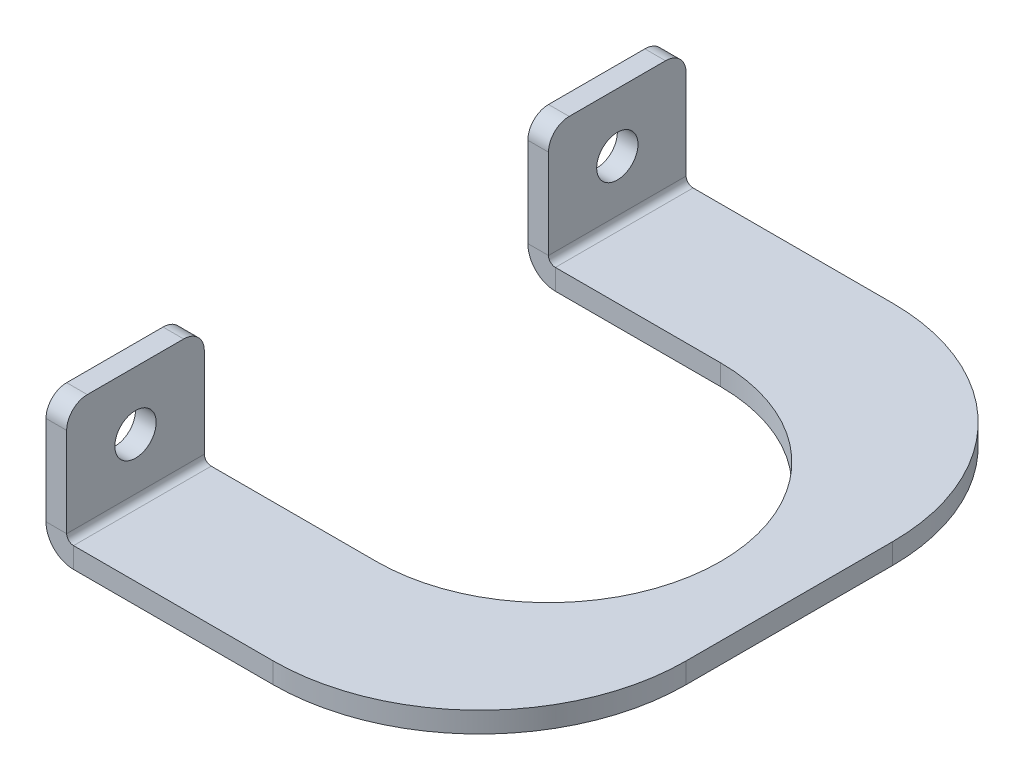
from build123d import *

# Parameters (mm, degrees)
BOSS_EXTRUDE1_DEPTH            = 3
EDGE_FLANGE1_STRIP_W           = 14
EDGE_FLANGE1_STRIP_H           = 3
EDGE_FLANGE1_STRIP_CUT_DEPTH   = 20
EDGE_FLANGE1_STRIP_2_W         = 14
EDGE_FLANGE1_STRIP_2_H         = 3
EDGE_FLANGE1_STRIP_CUT_2_DEPTH = 20
EDGE_FLANGE1_DEPTH             = 20
EDGE_FLANGE1_BEND_DEPTH        = 20
FILLET1_R                      = 3
CUT_EXTRUDE1_REACH             = 79.621
SKETCH12_R                     = 3


# Sheet-metal steps are written as plain solids
with BuildPart() as part:
    # Sketch1 → Boss-Extrude1 (new body)
    with BuildSketch(Plane(origin=(0, 0, 0), x_dir=(1, 0, 0), z_dir=(0, 1, 0))):
        with BuildLine():
            Line((0, 25), (-25, 25))
            Line((-25, 25), (-25, 45))
            Line((-25, 45), (5, 45))
            ThreePointArc((5, 45), (26.213203436, 36.213203436), (35, 15))
            Line((35, 15), (35, -15))
            ThreePointArc((35, -15), (26.213203436, -36.213203436), (5, -45))
            Line((5, -45), (-25, -45))
            Line((-25, -45), (-25, -25))
            Line((-25, -25), (0, -25))
            ThreePointArc((0, -25), (25, 0), (0, 25))
        make_face()
    extrude(amount=BOSS_EXTRUDE1_DEPTH)

    # Edge-Flange1 strip (across the edge) → Edge-Flange1 strip cut (cut)
    with BuildSketch(Plane(origin=(-25, 3, 25), x_dir=(1, 0, 0), z_dir=(0, 0, 1))):
        with Locations((-6, -1.5)):
            Rectangle(EDGE_FLANGE1_STRIP_W, EDGE_FLANGE1_STRIP_H)
    extrude(amount=EDGE_FLANGE1_STRIP_CUT_DEPTH, mode=Mode.SUBTRACT)

    # Edge-Flange1 strip 2 (across the edge) → Edge-Flange1 strip cut 2 (cut)
    with BuildSketch(Plane(origin=(-25, 3, -45), x_dir=(1, 0, 0), z_dir=(0, 0, 1))):
        with Locations((-6, -1.5)):
            Rectangle(EDGE_FLANGE1_STRIP_2_W, EDGE_FLANGE1_STRIP_2_H)
    extrude(amount=EDGE_FLANGE1_STRIP_CUT_2_DEPTH, mode=Mode.SUBTRACT)

    # Edge-Flange1 section (across the edge) → Edge-Flange1 (add)
    with BuildSketch(Plane(origin=(-25, 3, 25), x_dir=(1, 0, 0), z_dir=(0, 0, 1))):
        with BuildLine():
            Line((-3, 1), (-3, 17))
            Line((-3, 17), (0, 17))
            Line((0, 17), (0, 1))
            ThreePointArc((0, 1), (0.292893219, 0.292893219), (1, 0))
            Line((1, 0), (1, -3))
            ThreePointArc((1, -3), (-1.828427125, -1.828427125), (-3, 1))
        make_face()
    extrude(amount=EDGE_FLANGE1_DEPTH)

    # Edge-Flange1 section 2 (across the edge) → Edge-Flange1 bend (add)
    with BuildSketch(Plane(origin=(-25, 3, -45), x_dir=(1, 0, 0), z_dir=(0, 0, 1))):
        with BuildLine():
            Line((-3, 1), (-3, 17))
            Line((-3, 17), (0, 17))
            Line((0, 17), (0, 1))
            ThreePointArc((0, 1), (0.292893219, 0.292893219), (1, 0))
            Line((1, 0), (1, -3))
            ThreePointArc((1, -3), (-1.828427125, -1.828427125), (-3, 1))
        make_face()
    extrude(amount=EDGE_FLANGE1_BEND_DEPTH)

    # Fillet1
    fillet1_edges = [part.edges().sort_by_distance(p)[0] for p in [
        (-26.5, 20, 25),
        (-26.5, 20, 45),
        (-26.5, 20, -45),
        (-26.5, 20, -25),
    ]]
    fillet(fillet1_edges, radius=FILLET1_R)

    # Sketch12 → Cut-Extrude1 (cut, up to next)
    with BuildSketch(Plane(origin=(-25, 0, 0), x_dir=(0, 0, -1), z_dir=(1, 0, 0)), mode=Mode.PRIVATE) as cut_extrude1_sk1:
        with Locations(Location((35, 11.5, 0), (0, 0, 90))):
            Circle(SKETCH12_R)
    cut_extrude1_tool1 = extrude(cut_extrude1_sk1.sketch, amount=-CUT_EXTRUDE1_REACH, mode=Mode.PRIVATE) & part.part
    # Sketch12 → Cut-Extrude1 (cut, up to next)
    with BuildSketch(Plane(origin=(-25, 0, 0), x_dir=(0, 0, -1), z_dir=(1, 0, 0)), mode=Mode.PRIVATE) as cut_extrude1_sk2:
        with Locations(Location((-35, 11.5, 0), (0, 0, 90))):
            Circle(SKETCH12_R)
    cut_extrude1_tool2 = extrude(cut_extrude1_sk2.sketch, amount=-CUT_EXTRUDE1_REACH, mode=Mode.PRIVATE) & part.part
    add(cut_extrude1_tool1.solids().sort_by_distance((-25, 11.5, -35))[0], mode=Mode.SUBTRACT)
    add(cut_extrude1_tool2.solids().sort_by_distance((-25, 11.5, 35))[0], mode=Mode.SUBTRACT)


solid = part.part
